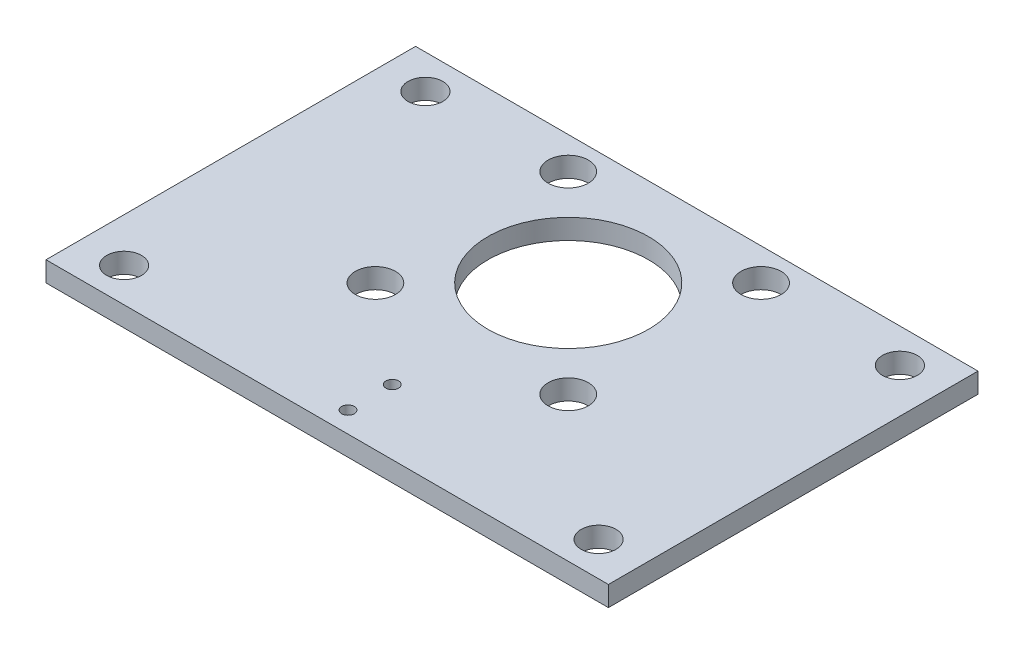
from build123d import *

# Parameters (mm, degrees)
SKETCH1_W                  = 177.8
SKETCH1_H                  = 116.84
BOSS_EXTRUDE1_DEPTH        = 3.175
F_1_1_DIAMETER_HOLE1_D     = 50.8
F_1_2_0_5_DIAMETER_HOLE1_D = 12.7
F_4_0_4_DIAMETER_HOLE1_D   = 4
M10_CLEARANCE_HOLE1_D      = 11


with BuildPart() as part:
    # Sketch1 → Boss-Extrude1 (new, symmetric)
    with BuildSketch(Plane(origin=(0, 0, 0), x_dir=(1, 0, 0), z_dir=(0, 1, 0))):
        with Locations((0, -17.78)):
            Rectangle(SKETCH1_W, SKETCH1_H)
    extrude(amount=BOSS_EXTRUDE1_DEPTH, both=True)

    # 1 (1) Diameter Hole1 (through all)
    with Locations(Plane(origin=(0, 3.175, 0), x_dir=(1, 0, 0), z_dir=(0, 1, 0))):
        with Locations((0, 0)):
            Hole(F_1_1_DIAMETER_HOLE1_D / 2)

    # 1/2 (0.5) Diameter Hole1 (through all)
    with Locations(Plane(origin=(0, 3.175, 0), x_dir=(1, 0, 0), z_dir=(0, 1, 0))):
        with Locations((30.48, -30.48), (-30.48, 30.48), (-30.48, -30.48), (30.48, 30.48)):
            Hole(F_1_2_0_5_DIAMETER_HOLE1_D / 2)

    # Ø4.0 (4) Diameter Hole1 (through all)
    with Locations(Plane(origin=(0, 3.175, 0), x_dir=(1, 0, 0), z_dir=(0, 1, 0))):
        with Locations((0, -55.63), (0, -69.63)):
            Hole(F_4_0_4_DIAMETER_HOLE1_D / 2)

    # M10 Clearance Hole1 (through all)
    with Locations(Plane(origin=(0, 3.175, 0), x_dir=(1, 0, 0), z_dir=(0, 1, 0))):
        with Locations((75, -65.405), (-75, 29.845), (-75, -65.405), (75, 29.845)):
            Hole(M10_CLEARANCE_HOLE1_D / 2)


solid = part.part
